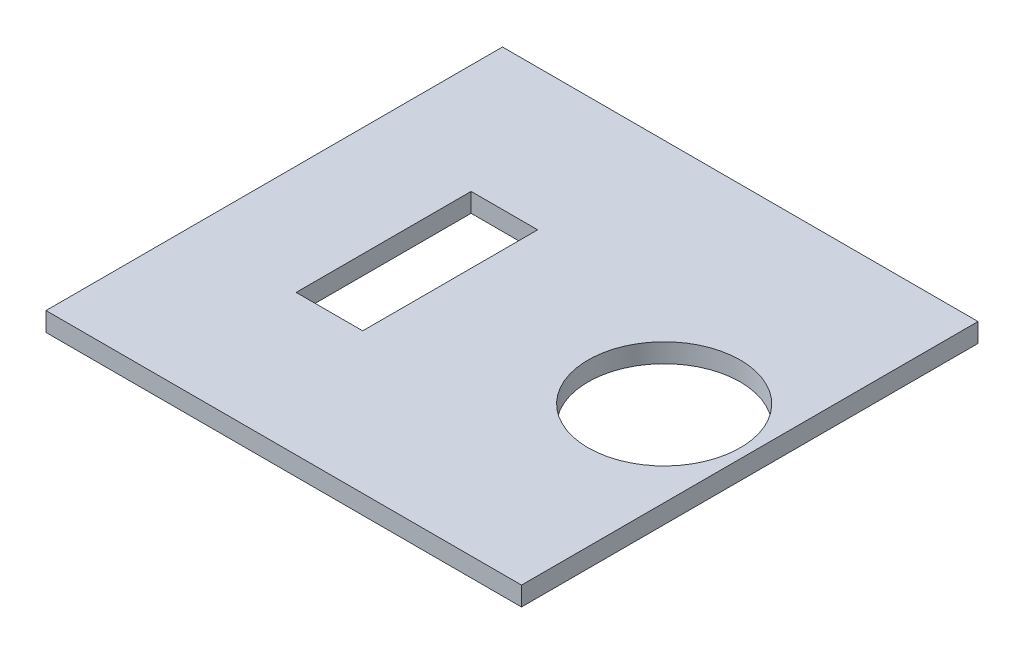
from build123d import *

# Parameters (mm, degrees)
SKETCH1_W           = 25
SKETCH1_H           = 24
SKETCH1_R           = 4
SKETCH1_W_2         = 3.5
SKETCH1_H_2         = 9.2
BOSS_EXTRUDE1_DEPTH = 1


with BuildPart() as part:
    # Sketch1 → Boss-Extrude1 (new body)
    with BuildSketch(Plane(origin=(0, 0, 0), x_dir=(1, 0, 0), z_dir=(0, 1, 0))):
        Rectangle(SKETCH1_W, SKETCH1_H)
        with Locations((8, 0)):
            Circle(SKETCH1_R, mode=Mode.SUBTRACT)
        with Locations((-5, 0)):
            Rectangle(SKETCH1_W_2, SKETCH1_H_2, mode=Mode.SUBTRACT)
    extrude(amount=BOSS_EXTRUDE1_DEPTH)


solid = part.part
